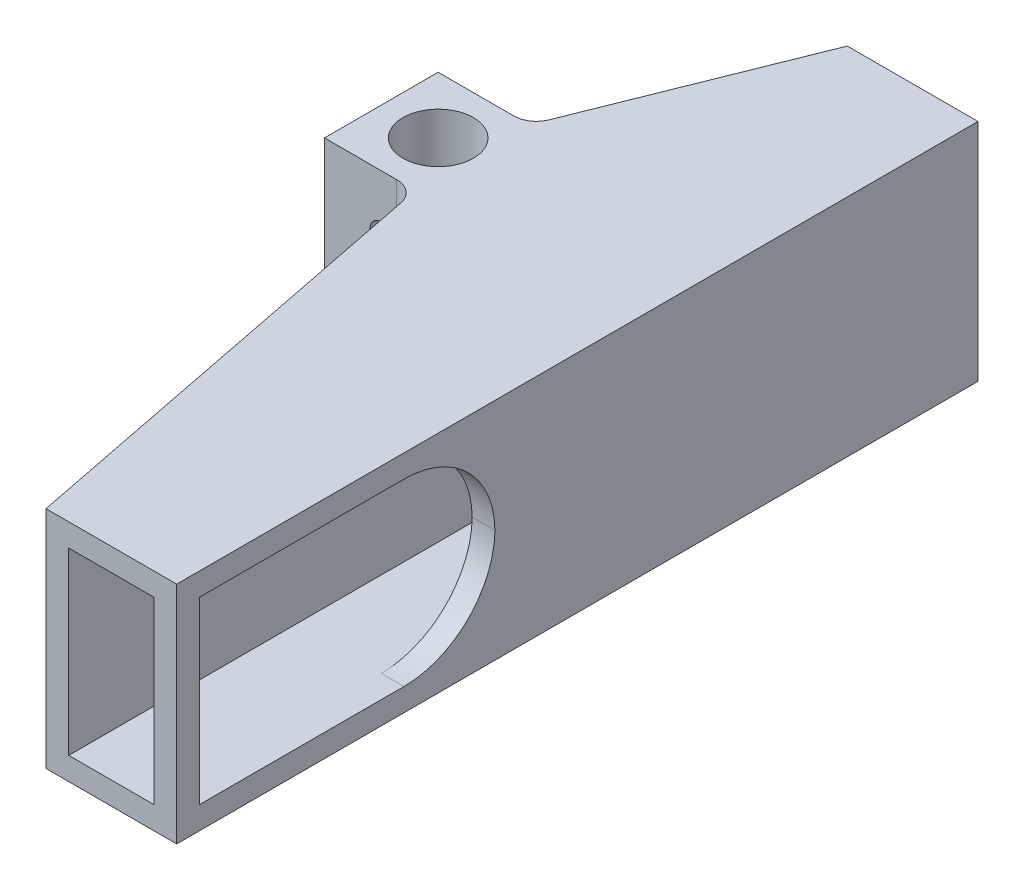
from build123d import *

# Parameters (mm, degrees)
CROQUIS1_W                 = 19.8
CROQUIS1_H                 = 11.5
SALIENTE_EXTRUIR1_DEPTH    = 70.5
VACIADO1_T                 = -2
CROQUIS4_W                 = 15.8
CROQUIS4_H                 = 28
CORTAR_EXTRUIR1_DEPTH      = 2
REDONDEO1_R                = 8
CROQUIS5_W                 = 15.8
CROQUIS5_H                 = 2
SALIENTE_EXTRUIR2_DEPTH    = 2
CROQUIS6_W                 = 19.8
CROQUIS6_H                 = 10
SALIENTE_EXTRUIR4_DEPTH    = 16
SALIENTE_EXTRUIR5_DEPTH    = 19.8
CROQUIS10_R                = 3.1
CORTAR_EXTRUIR4_DEPTH      = 19.8
REDONDEO3_R                = 2
CORTAR_EXTRUIR5_DEPTH      = 52.393798264
CORTAR_EXTRUIR5_DEPTH_BACK = 52.393798264
CROQUIS11_R                = 1


with BuildPart() as part:
    # Croquis1 → Saliente-Extruir1 (new body)
    with BuildSketch(Plane(origin=(0, 0, 0), x_dir=(0, 1, 0), z_dir=(0, 0, 1))):
        Rectangle(CROQUIS1_W, CROQUIS1_H)
    extrude(amount=SALIENTE_EXTRUIR1_DEPTH)

    # Vaciado1
    vaciado1_openings = [part.faces().sort_by_distance(p)[0] for p in [
        (0, 0, 70.5),
    ]]
    offset(amount=VACIADO1_T, openings=vaciado1_openings, kind=Kind.INTERSECTION)

    # Croquis4 → Cortar-Extruir1 (cut)
    with BuildSketch(Plane.YZ.offset(5.75)):
        with Locations((0, 56.5)):
            Rectangle(CROQUIS4_W, CROQUIS4_H)
    extrude(amount=-CORTAR_EXTRUIR1_DEPTH, mode=Mode.SUBTRACT)

    # Redondeo1
    # the kernel refuses this fillet: 8 mm, written as the material it adds along each edge
    with BuildSketch(Plane(origin=(5.75, 7.9, 42.5), x_dir=(0, -1, 0), z_dir=(-1, 0, 0)), Plane(origin=(5.75, -7.9, 42.5), x_dir=(0, 0, 1), z_dir=(-1, 0, 0))) as redondeo1_piece_1:
        with BuildLine():
            CenterArc((REDONDEO1_R, REDONDEO1_R), REDONDEO1_R, 180, 90)
            Line((0, REDONDEO1_R), (0, 0))
            Line((0, 0), (REDONDEO1_R, 0))
        make_face()
    extrude(amount=2)

    # Croquis5 → Saliente-Extruir2 (add)
    with BuildSketch(Plane.YZ.offset(5.75)):
        with Locations((0, 69.5)):
            Rectangle(CROQUIS5_W, CROQUIS5_H)
    extrude(amount=-SALIENTE_EXTRUIR2_DEPTH)

    # Croquis6 → Saliente-Extruir4 (add)
    with BuildSketch(Plane(origin=(-5.75, 0, 0), x_dir=(0, -1, 0), z_dir=(-1, 0, 0))):
        with Locations((0, 25)):
            Rectangle(CROQUIS6_W, CROQUIS6_H)
    extrude(amount=SALIENTE_EXTRUIR4_DEPTH)

    # Croquis9 → Saliente-Extruir5 (add)
    with BuildSketch(Plane.XZ.offset(9.9)):
        Polygon((-5.75, 70.5), (-13.75, 30), (-5.75, 30), align=None)
        Polygon((-5.75, 0), (-13.75, 20), (-5.75, 20), align=None)
    extrude(amount=-SALIENTE_EXTRUIR5_DEPTH)

    # Croquis10 → Cortar-Extruir4 (cut)
    with BuildSketch(Plane.XZ.offset(9.9)):
        with Locations(Location((-16.745253682, 25, 0), (0, 0, 270))):
            Circle(CROQUIS10_R)
    extrude(amount=-CORTAR_EXTRUIR4_DEPTH, mode=Mode.SUBTRACT)

    # Redondeo3
    redondeo3_edges = [part.edges().sort_by_distance(p)[0] for p in [
        (-13.75, 0, 20),
        (-13.75, 0, 30),
    ]]
    fillet(redondeo3_edges, radius=REDONDEO3_R)

    # Croquis11 → Cortar-Extruir5 (cut, two sides: drawn at the far end of the back side and taken through both)
    with BuildSketch(Plane(origin=(0, 0, 25), x_dir=(0, -1, 0), z_dir=(0, 0, 1)).offset(-CORTAR_EXTRUIR5_DEPTH_BACK)):
        with Locations(Location((-5, -16.745253682, 0), (0, 0, 90))):
            Circle(CROQUIS11_R)
        with Locations(Location((5, -16.745253682, 0), (0, 0, 90))):
            Circle(CROQUIS11_R)
    extrude(amount=CORTAR_EXTRUIR5_DEPTH + CORTAR_EXTRUIR5_DEPTH_BACK, mode=Mode.SUBTRACT)


solid = part.part
